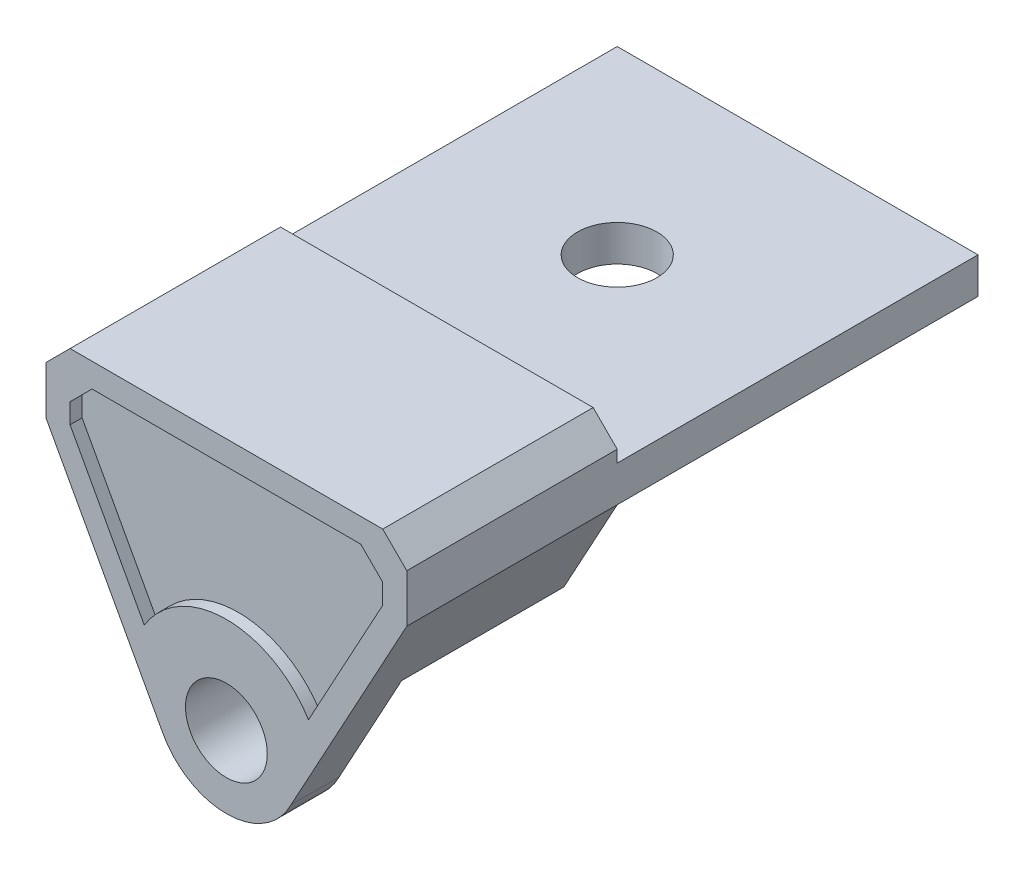
from build123d import *
from build123d.topology import SkipClean

# Parameters (mm, degrees)
BOSS_EXTRUDE1_DEPTH  = 2
BOSS_EXTRUDE2_START  = 4.75
BOSS_EXTRUDE2_DEPTH  = 4.75
BOSS_EXTRUDE3_START  = 2
SKETCH3_R            = 1.7
BOSS_EXTRUDE3_DEPTH  = 2
SKETCH4_R            = 2.2
SKETCH4_R_2          = 1.7
BOSS_EXTRUDE4_DEPTH  = 0.5
CHAMFER1_SIZE        = 0.5
SKETCH5_W            = 7.5
SKETCH5_H            = 3
BOSS_EXTRUDE5_DEPTH  = 2
BOSS_EXTRUDE6_DEPTH  = 6.75
BOSS_EXTRUDE8_DEPTH  = 6.75
SKETCH10_W           = 15
SKETCH10_H           = 3
BOSS_EXTRUDE9_DEPTH  = 15
SKETCH11_R           = 1.65
CUT_EXTRUDE1_DEPTH   = 22.34244597
FILLET1_START        = -3
FILLET1_DEPTH        = 7.75
CHAMFER6_SIZE        = 1.5
BOSS_EXTRUDE11_START = -6.75
BOSS_EXTRUDE11_DEPTH = 6.75
BOSS_EXTRUDE12_REACH = 29.029
SKETCH16_W           = 15
SKETCH16_H           = 1.5
CUT_EXTRUDE3_DEPTH   = 0.5
SKETCH17_W           = 15
SKETCH17_H           = 1.5
CUT_EXTRUDE4_DEPTH   = 15
CHAMFER8_SIZE        = 1


with BuildPart() as part:
    # Sketch1 → Boss-Extrude1 (new body)
    with BuildSketch(Plane.XY):
        with BuildLine():
            Line((4.594082841, 4.876925553), (5.159993549, 5.442836262))
            ThreePointArc((5.159993549, 5.442836262), (0, 7.5), (-5.159993549, 5.442836262))
            Line((-5.159993549, 5.442836262), (-4.594082841, 4.876925553))
            ThreePointArc((-4.594082841, 4.876925553), (0, 6.7), (4.594082841, 4.876925553))
        make_face()
    extrude(amount=-BOSS_EXTRUDE1_DEPTH)

    # Sketch1<3> → Boss-Extrude2 (add)
    with BuildSketch(Plane.XY.offset(BOSS_EXTRUDE2_START)):
        with BuildLine():
            Line((4.594082841, 4.876925553), (5.159993549, 5.442836262))
            ThreePointArc((5.159993549, 5.442836262), (0, 7.5), (-5.159993549, 5.442836262))
            Line((-5.159993549, 5.442836262), (-4.594082841, 4.876925553))
            ThreePointArc((-4.594082841, 4.876925553), (0, 6.7), (4.594082841, 4.876925553))
        make_face()
        with BuildLine():
            Line((4.454772721, 4.454772721), (4.596194078, 4.596194078))
            Line((4.596194078, 4.596194078), (5.303300859, 5.303300859))
            ThreePointArc((5.303300859, 5.303300859), (5.232112384, 5.373546315), (5.159993549, 5.442836262))
            Line((5.159993549, 5.442836262), (4.594082841, 4.876925553))
            ThreePointArc((4.594082841, 4.876925553), (0, 6.7), (-4.594082841, 4.876925553))
            Line((-4.594082841, 4.876925553), (-5.159993549, 5.442836262))
            ThreePointArc((-5.159993549, 5.442836262), (-5.232112384, 5.373546315), (-5.303300859, 5.303300859))
            Line((-5.303300859, 5.303300859), (-4.596194078, 4.596194078))
            Line((-4.596194078, 4.596194078), (-4.454772721, 4.454772721))
            ThreePointArc((-4.454772721, 4.454772721), (0, 6.3), (4.454772721, 4.454772721))
        make_face()
    extrude(amount=-BOSS_EXTRUDE2_DEPTH)

    # Sketch3 → Boss-Extrude3 (add)
    with BuildSketch(Plane.XY.offset(4.75).offset(BOSS_EXTRUDE3_START)):
        with BuildLine():
            ThreePointArc((5.303300859, 5.303300859), (0, 7.5), (-5.303300859, 5.303300859))
            Line((-5.303300859, 5.303300859), (-2.792750347, -1.095694072))
            ThreePointArc((-2.792750347, -1.095694072), (0, -3), (2.792750347, -1.095694072))
            Line((2.792750347, -1.095694072), (5.303300859, 5.303300859))
        make_face()
        Circle(SKETCH3_R, mode=Mode.SUBTRACT)
    extrude(amount=-BOSS_EXTRUDE3_DEPTH)

    # Sketch4 → Boss-Extrude4 (add)
    with SkipClean():  # the faces are left unmerged after this step: merging them gives an invalid solid
        with BuildSketch(Plane(origin=(0, 0, 4.75), x_dir=(-1, 0, 0), z_dir=(0, 0, -1))):
            with Locations(Location((0, 0, 0), (0, 0, 180))):
                Circle(SKETCH4_R)
            Circle(SKETCH4_R_2, mode=Mode.SUBTRACT)
        extrude(amount=BOSS_EXTRUDE4_DEPTH)
    add(part.part.scale(1), mode=Mode.REPLACE)  # the faces are merged on a copy

    # Chamfer1
    chamfer1_edges = [part.edges().sort_by_distance(p)[0] for p in [
        (-2.2, 0, 4.75),
    ]]
    chamfer(chamfer1_edges, length=CHAMFER1_SIZE - 0.0001)  # a hair under: the kernel refuses the full size

    # Sketch5 → Boss-Extrude5 (add)
    with BuildSketch(Plane.XY.offset(6.75)):
        with BuildLine():
            ThreePointArc((-5.303300859, 5.303300859), (-2.870125743, 6.929096494), (0, 7.5))
            Line((0, 7.5), (-7.5, 7.5))
            Line((-7.5, 7.5), (-2.634698995, -1.434698995))
            ThreePointArc((-2.634698995, -1.434698995), (-2.71901318, -1.26766215), (-2.792750347, -1.095694072))
            Line((-2.792750347, -1.095694072), (-5.303300859, 5.303300859))
        make_face()
        with Locations((-3.75, 9)):
            Rectangle(SKETCH5_W, SKETCH5_H)
        with Locations((3.75, 9)):
            Rectangle(SKETCH5_W, SKETCH5_H)
        with BuildLine():
            Line((7.5, 7.5), (0, 7.5))
            ThreePointArc((0, 7.5), (2.870125743, 6.929096494), (5.303300859, 5.303300859))
            Line((5.303300859, 5.303300859), (2.792750347, -1.095694072))
            ThreePointArc((2.792750347, -1.095694072), (2.740333064, -1.220890945), (2.682306676, -1.343588812))
            Line((2.682306676, -1.343588812), (7.5, 7.5))
        make_face()
    extrude(amount=-BOSS_EXTRUDE5_DEPTH)

    # Sketch6 → Boss-Extrude6 (add)
    with BuildSketch(Plane(origin=(0, 0, 4.75), x_dir=(-1, 0, 0), z_dir=(0, 0, -1))):
        with BuildLine():
            Line((-5.921621025, 4.602651891), (-5.499242594, 3.827313795))
            ThreePointArc((-5.499242594, 3.827313795), (-5.138626065, 4.299362995), (-4.737615434, 4.737615434))
            Line((-4.737615434, 4.737615434), (-5.303300859, 5.303300859))
            ThreePointArc((-5.303300859, 5.303300859), (-5.623383774, 4.962615735), (-5.921621025, 4.602651891))
        make_face()
        with BuildLine():
            ThreePointArc((4.737615434, 4.737615434), (5.13888851, 4.2990493), (5.499709828, 3.826642367))
            Line((5.499709828, 3.826642367), (5.922007367, 4.602154794))
            ThreePointArc((5.922007367, 4.602154794), (5.623592059, 4.962379707), (5.303300859, 5.303300859))
            Line((5.303300859, 5.303300859), (4.737615434, 4.737615434))
        make_face()
    extrude(amount=BOSS_EXTRUDE6_DEPTH)

    # Sketch8 → Boss-Extrude8 (add)
    with BuildSketch(Plane(origin=(0, 0, 4.75), x_dir=(-1, 0, 0), z_dir=(0, 0, -1))):
        with BuildLine():
            Line((5.922007367, 4.602154794), (7.5, 7.5))
            Line((7.5, 7.5), (7.5, 10.5))
            Line((7.5, 10.5), (-7.5, 10.5))
            Line((-7.5, 10.5), (-7.5, 7.5))
            Line((-7.5, 7.5), (-5.921621025, 4.602651891))
            ThreePointArc((-5.921621025, 4.602651891), (0.000314788, 7.499999993), (5.922007367, 4.602154794))
        make_face()
    extrude(amount=BOSS_EXTRUDE8_DEPTH)

    # Sketch10 → Boss-Extrude9 (add)
    with BuildSketch(Plane(origin=(0, 0, -2), x_dir=(-1, 0, 0), z_dir=(0, 0, -1))):
        with Locations((0, 9)):
            Rectangle(SKETCH10_W, SKETCH10_H)
    extrude(amount=BOSS_EXTRUDE9_DEPTH)

    # Sketch11 → Cut-Extrude1 (cut, through all)
    with BuildSketch(Plane.XZ.offset(-7.5)):
        with Locations(Location((0, -9.5, 0), (0, 0, 270))):
            Circle(SKETCH11_R)
    extrude(amount=-CUT_EXTRUDE1_DEPTH, mode=Mode.SUBTRACT)

    # Fillet1: read off the stored shape, not the designer's step
    # Fillet1 outline → Fillet1 (cut)
    with BuildSketch(Plane.XY.offset(FILLET1_START)):
        with BuildLine():
            ThreePointArc((-5.316260804, 4.077667356), (-5.490505676, 3.999994233), (-5.650601756, 4.10374217))
            Line((-5.650601756, 4.10374217), (-5.499709828, 3.826642367))
            ThreePointArc((-5.499709828, 3.826642367), (-5.409441613, 3.953219123), (-5.316260804, 4.077667356))
        make_face()
        with BuildLine():
            ThreePointArc((5.650134675, 4.104298532), (5.49004858, 4.000580786), (5.315823507, 4.078237419))
            ThreePointArc((5.315823507, 4.078237419), (5.408988293, 3.953839354), (5.499242594, 3.827313795))
            Line((5.499242594, 3.827313795), (5.650134675, 4.104298532))
        make_face()
    extrude(amount=FILLET1_DEPTH, mode=Mode.SUBTRACT)

    # Chamfer6
    chamfer6_edges = [part.edges().sort_by_distance(p)[0] for p in [
        (7.5, 10.5, -5.125),
        (-7.5, 10.5, -5.125),
    ]]
    chamfer(chamfer6_edges, length=CHAMFER6_SIZE)

    # Sketch12 → Boss-Extrude11 (add)
    with BuildSketch(Plane(origin=(0, 0, -2), x_dir=(-1, 0, 0), z_dir=(0, 0, -1)).offset(BOSS_EXTRUDE11_START)):
        with BuildLine():
            Line((-5.303300859, 5.303300859), (-5.210007514, 5.210007514))
            ThreePointArc((-5.210007514, 5.210007514), (-5.138810365, 5.280244751), (-5.066666421, 5.349509134))
            Line((-5.066666421, 5.349509134), (-5.159993549, 5.442836262))
            ThreePointArc((-5.159993549, 5.442836262), (-5.232112384, 5.373546315), (-5.303300859, 5.303300859))
        make_face()
        with BuildLine():
            ThreePointArc((-5.315823507, 4.078237419), (-5.49004858, 4.000580786), (-5.650134675, 4.104298532))
            Line((-5.650134675, 4.104298532), (-5.283538928, 3.431357806))
            ThreePointArc((-5.283538928, 3.431357806), (0.000460722, 6.299999983), (5.284040746, 3.430584993))
            Line((5.284040746, 3.430584993), (5.650601756, 4.10374217))
            ThreePointArc((5.650601756, 4.10374217), (5.490505675, 3.999994233), (5.316260804, 4.077667356))
            ThreePointArc((5.316260804, 4.077667356), (5.037756417, 4.417126926), (4.737615434, 4.737615434))
            Line((4.737615434, 4.737615434), (5.210007514, 5.210007514))
            ThreePointArc((5.210007514, 5.210007514), (5.138810365, 5.280244751), (5.066666421, 5.349509134))
            Line((5.066666421, 5.349509134), (4.594082841, 4.876925553))
            ThreePointArc((4.594082841, 4.876925553), (0, 6.7), (-4.594082841, 4.876925553))
            Line((-4.594082841, 4.876925553), (-5.066666421, 5.349509134))
            ThreePointArc((-5.066666421, 5.349509134), (-5.138810365, 5.280244751), (-5.210007514, 5.210007514))
            Line((-5.210007514, 5.210007514), (-4.737615434, 4.737615434))
            ThreePointArc((-4.737615434, 4.737615434), (-5.037519576, 4.41739703), (-5.315823507, 4.078237419))
        make_face()
        with BuildLine():
            Line((-5.85264511, 4.476036395), (-5.650134675, 4.104298532))
            ThreePointArc((-5.650134675, 4.104298532), (-5.49004858, 4.000580786), (-5.315823507, 4.078237419))
            ThreePointArc((-5.315823507, 4.078237419), (-5.037519576, 4.41739703), (-4.737615434, 4.737615434))
            Line((-4.737615434, 4.737615434), (-5.210007514, 5.210007514))
            ThreePointArc((-5.210007514, 5.210007514), (-5.543487095, 4.85366948), (-5.85264511, 4.476036395))
        make_face()
        with BuildLine():
            Line((5.159993549, 5.442836262), (5.066666421, 5.349509134))
            ThreePointArc((5.066666421, 5.349509134), (5.138810365, 5.280244751), (5.210007514, 5.210007514))
            Line((5.210007514, 5.210007514), (5.303300859, 5.303300859))
            ThreePointArc((5.303300859, 5.303300859), (5.232112384, 5.373546315), (5.159993549, 5.442836262))
        make_face()
        with BuildLine():
            ThreePointArc((5.316260804, 4.077667356), (5.490505675, 3.999994233), (5.650601756, 4.10374217))
            Line((5.650601756, 4.10374217), (5.853045643, 4.47551263))
            ThreePointArc((5.853045643, 4.47551263), (5.543704265, 4.853421435), (5.210007514, 5.210007514))
            Line((5.210007514, 5.210007514), (4.737615434, 4.737615434))
            ThreePointArc((4.737615434, 4.737615434), (5.037756417, 4.417126926), (5.316260804, 4.077667356))
        make_face()
    extrude(amount=BOSS_EXTRUDE11_DEPTH)

    # Boss-Extrude12: up to this face of the body (flat: up to its plane)
    boss_extrude12_end = Plane(part.part.faces().sort_by_distance((-0.00029363, 5.45528482, 6.75))[0])
    # Sketch16 → Boss-Extrude12 (add, up to the picked face)
    with BuildSketch(Plane(origin=(0, 0, -17), x_dir=(-1, 0, 0), z_dir=(0, 0, -1)), mode=Mode.PRIVATE) as boss_extrude12_sk1:
        with Locations((0, 9.75)):
            Rectangle(SKETCH16_W, SKETCH16_H)
    boss_extrude12_tool1 = split(extrude(boss_extrude12_sk1.sketch, amount=-BOSS_EXTRUDE12_REACH, mode=Mode.PRIVATE), bisect_by=boss_extrude12_end, keep=Keep.BOTH, mode=Mode.PRIVATE)
    add(boss_extrude12_tool1.solids().sort_by(Axis((0, 9.75, -17), (0, 0, 1)))[0])

    # Sketch13 → Cut-Extrude3 (cut)
    with BuildSketch(Plane.XY.offset(6.75)):
        with BuildLine():
            ThreePointArc((3.4124071, 2.086978147), (-0.000677338, 3.999999943), (-3.413113698, 2.085822351))
            Line((-3.413113698, 2.085822351), (-6.5, 7.754618569))
            Line((-6.5, 7.754618569), (-6.5, 8.585786438))
            Line((-6.5, 8.585786438), (-5.585786438, 9.5))
            Line((-5.585786438, 9.5), (5.585786438, 9.5))
            Line((5.585786438, 9.5), (6.5, 8.585786438))
            Line((6.5, 8.585786438), (6.5, 7.754711685))
            Line((6.5, 7.754711685), (3.4124071, 2.086978147))
        make_face()
    extrude(amount=-CUT_EXTRUDE3_DEPTH, mode=Mode.SUBTRACT)

    # Sketch17 → Cut-Extrude4 (cut)
    with BuildSketch(Plane(origin=(0, 0, -17), x_dir=(-1, 0, 0), z_dir=(0, 0, -1))):
        with Locations((0, 9.75)):
            Rectangle(SKETCH17_W, SKETCH17_H)
    extrude(amount=-CUT_EXTRUDE4_DEPTH, mode=Mode.SUBTRACT)

    # Chamfer8
    chamfer8_edges = [part.edges().sort_by_distance(p)[0] for p in [
        (7.5, 10.5, 2.375),
        (-7.5, 10.5, 2.375),
    ]]
    chamfer(chamfer8_edges, length=CHAMFER8_SIZE)


solid = part.part
